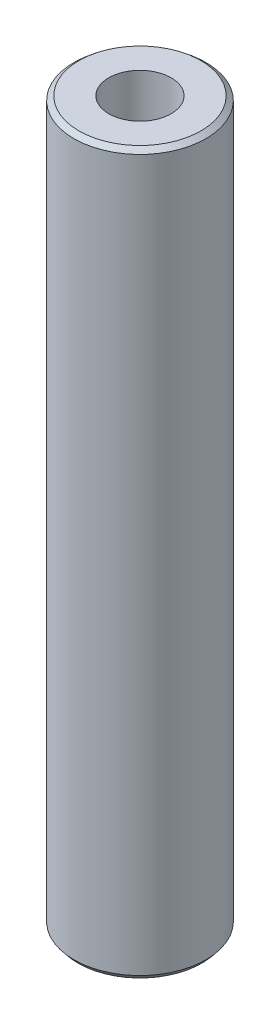
from build123d import *
from OCP.BRepFilletAPI import BRepFilletAPI_MakeChamfer

# Parameters (mm, degrees)
SKETCH1_R           = 55
BOSS_EXTRUDE1_DEPTH = 600
SKETCH2_R           = 25.989611905
CUT_EXTRUDE1_DEPTH  = 606.020660804
CHAMFER1_SIZE       = 3.459468396
CHAMFER1_SIZE2      = 4.224455147


with BuildPart() as part:
    # Sketch1 → Boss-Extrude1 (new body)
    with BuildSketch(Plane(origin=(0, 0, 0), x_dir=(1, 0, 0), z_dir=(0, 1, 0))):
        Circle(SKETCH1_R)
    extrude(amount=BOSS_EXTRUDE1_DEPTH)

    # Sketch2 → Cut-Extrude1 (cut, through all)
    with BuildSketch(Plane(origin=(0, 0, 0), x_dir=(1, 0, 0), z_dir=(0, 1, 0))):
        Circle(SKETCH2_R)
    extrude(amount=CUT_EXTRUDE1_DEPTH, mode=Mode.SUBTRACT)

    # Chamfer1: one chamfer whose edges measure the first distance from different faces: ONE call of the kernel's chamfer builder (chamfer() names one face for all edges)
    chamfer1_edges_1 = [part.edges().sort_by_distance(p)[0] for p in [
        (-55, 600, 0),
    ]]
    chamfer1_side_1 = [part.faces().sort_by_distance(p)[0] for p in [
        (-55, 300, 0),
    ]]
    chamfer1_edges_2 = [part.edges().sort_by_distance(p)[0] for p in [
        (-55, 0, 0),
    ]]
    chamfer1_side_2 = [part.faces().sort_by_distance(p)[0] for p in [
        (-53.444365081, 0, 0),
    ]]
    chamfer1 = BRepFilletAPI_MakeChamfer(part.part.solid().wrapped)
    for e in chamfer1_edges_1:
        chamfer1.Add(CHAMFER1_SIZE, CHAMFER1_SIZE2, e.wrapped, chamfer1_side_1[0].wrapped)  # the first distance lies on this face
    for e in chamfer1_edges_2:
        chamfer1.Add(CHAMFER1_SIZE, CHAMFER1_SIZE2, e.wrapped, chamfer1_side_2[0].wrapped)  # the first distance lies on this face
    add(Compound.cast(chamfer1.Shape()), mode=Mode.REPLACE)


solid = part.part
